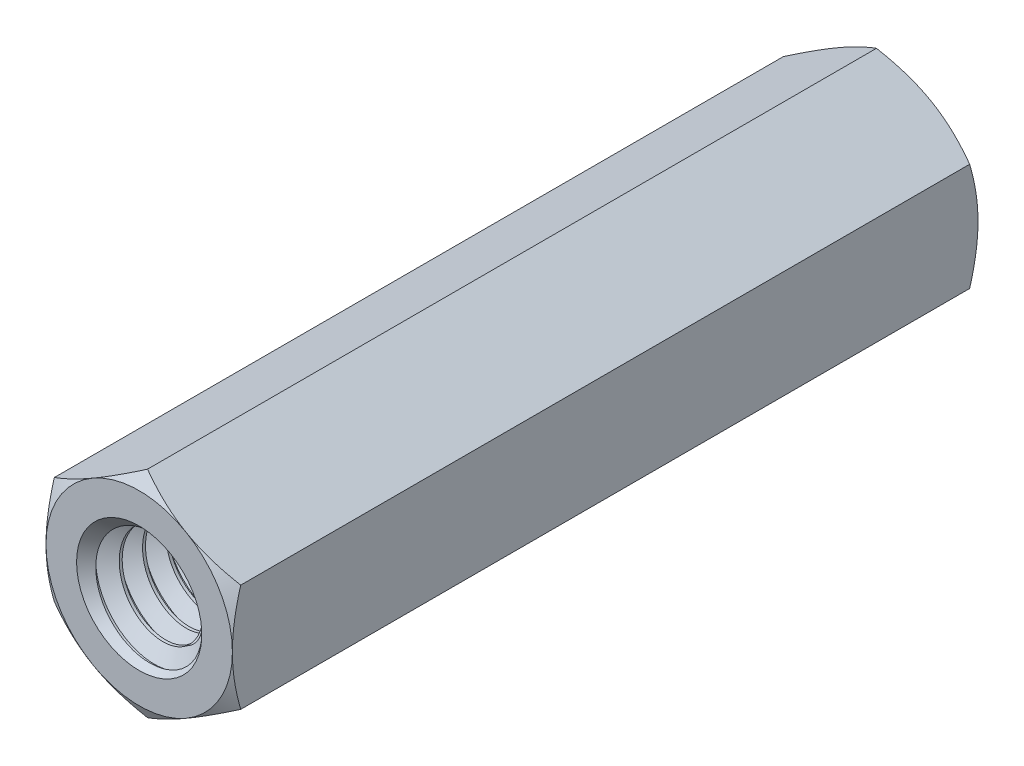
from build123d import *

# Parameters (mm, degrees)
EXTRUDE1_DEPTH          = 12.7
EXTRUDE1_DEPTH_BACK     = 12.7
SKETCH1_R               = 2.0828
SWEEP1_PITCH            = 0.79375
EXTRUDE2_DEPTH          = 27.639126821
SKETCH8_OUTSIDE_W       = 109.682
SKETCH8_OUTSIDE_H       = 110.664
SKETCH8_OUTSIDE_R       = 3.175
EXTRUDE4_DEPTH          = 27.639126821
EXTRUDE4_DRAFT          = -60
MIRROR1_COPY_1_SKETCH_W = 109.682
MIRROR1_COPY_1_SKETCH_H = 110.664
MIRROR1_COPY_1_SKETCH_R = 3.175
MIRROR1_COPY_1_DEPTH    = 27.639126821
MIRROR1_COPY_1_DRAFT    = -60


with BuildPart() as part:
    # Sketch1 → Extrude1 (new, two sides: drawn at the far end of the back side and taken through both)
    with BuildSketch(Plane.XY.offset(-EXTRUDE1_DEPTH_BACK)):
        Polygon((0, 3.666174209), (-3.175, 1.833087105), (-3.175, -1.833087105), (0, -3.666174209), (3.175, -1.833087105), (3.175, 1.833087105), align=None)
        Circle(SKETCH1_R, mode=Mode.SUBTRACT)
    extrude(amount=EXTRUDE1_DEPTH + EXTRUDE1_DEPTH_BACK)

    # Sweep1: arcs per turn and ends read off the stored shape
    # Sweep1: the profile of Sketch12 profile screwed along a right-hand helix through 33 turns, 8 arcs to a turn; built about Z, then put on its axis
    sweep1_z = Axis((0, 0, 0), (0, 0, 1))
    sweep1_corners = [(2.0831, 0, -0.694704455), (2.0831, 0, 0.000173205), (1.567244252, 0, -0.29765625), (1.567244252, 0, -0.396875)]
    with BuildLine(mode=Mode.PRIVATE) as sweep1_profile:
        Line(sweep1_corners[0], sweep1_corners[1])
        Line(sweep1_corners[1], sweep1_corners[2])
        Line(sweep1_corners[2], sweep1_corners[3])
        Line(sweep1_corners[3], sweep1_corners[0])
    sweep1_cap = Face(sweep1_profile.wire())
    sweep1_turn_angles = [0, 22.5, 45, 67.5, 90, 112.5, 135, 157.5, 180, 202.5, 225, 247.5, 270, 292.5, 315, 337.5, 360]
    sweep1_turn_weights = [1, 0.9238795325112867, 1, 0.9238795325112867, 1, 0.9238795325112867, 1, 0.9238795325112867, 1, 0.9238795325112867, 1, 0.9238795325112867, 1, 0.9238795325112867, 1, 0.9238795325112867, 1]
    sweep1_turn_rails = [Edge.make_bspline([Vector(p[0], p[1], 0).rotate(sweep1_z, sweep1_turn_angles[k]) / sweep1_turn_weights[k] + Vector(0, 0, p[2] + SWEEP1_PITCH * sweep1_turn_angles[k] / 360) for k in range(17)], [0, 0, 0, 1, 1, 2, 2, 3, 3, 4, 4, 5, 5, 6, 6, 7, 7, 8, 8, 8], 2, sweep1_turn_weights) for p in sweep1_corners]
    sweep1_turn_sides = [Face.make_surface_from_curves(sweep1_turn_rails[p[0]], sweep1_turn_rails[p[1]]) for p in [(0, 1), (1, 2), (2, 3), (3, 0)]]
    sweep1 = Plane(origin=(0, 0, -12.7), x_dir=(0, 1, 0), z_dir=(0, 0, 1)) * Solid(Shell([*[p.moved(Location((0, 0, SWEEP1_PITCH * i))) for i in range(33) for p in sweep1_turn_sides], sweep1_cap, sweep1_cap.rotate(sweep1_z, 11880).moved(Location((0, 0, SWEEP1_PITCH * 11880 / 360)))]))
    add(sweep1)

    # Sketch6 → Extrude2 (cut, through all)
    with BuildSketch(Plane(origin=(0, 0, -12.7), x_dir=(-1, 0, 0), z_dir=(0, 0, -1))):
        Polygon((0, 3.666174209), (-3.175, 1.833087105), (-3.175, -1.833087105), (0, -3.666174209), (3.175, -1.833087105), (3.175, 1.833087105), align=None)
    extrude2 = extrude(amount=EXTRUDE2_DEPTH, mode=Mode.SUBTRACT)

    # Extrude3 cone 1 section (through the dimple's axis) → Extrude3 (revolve, cut)
    with BuildSketch(Plane(origin=(0, 0, -12.7), x_dir=(0, 1, 0), z_dir=(1, 0, 0))):
        Polygon((0, 0), (2.1336, 0), (0, 2.28800588), align=None)
    extrude3 = revolve(axis=Axis((0, 0, -12.7), (0, 0, 1)), mode=Mode.SUBTRACT)


with BuildPart() as extrude4_tool:
    # Sketch8 outside → Extrude4 (with draft: the straight prism first)
    with BuildSketch(Plane(origin=(0, 0, -12.7), x_dir=(-1, 0, 0), z_dir=(0, 0, -1))):
        Rectangle(SKETCH8_OUTSIDE_W, SKETCH8_OUTSIDE_H)
        Circle(SKETCH8_OUTSIDE_R, mode=Mode.SUBTRACT)
    extrude(amount=-EXTRUDE4_DEPTH)
    # Extrude4: the draft: its side faces are tilted about the plane it starts from
    extrude4_sides = [extrude4_tool.faces().sort_by_distance(p)[0] for p in [
        (0, -55.332, 1.119563411),
        (-54.841, 0, 1.119563411),
        (0, 55.332, 1.119563411),
        (54.841, 0, 1.119563411),
        (3.175, 0, 1.119563411),
    ]]
    draft(extrude4_sides, Plane(origin=(0, 0, -12.7), x_dir=(-1, 0, 0), z_dir=(0, 0, -1)), EXTRUDE4_DRAFT)


with BuildPart() as part_1:
    add(part.part)

    # Extrude4: cut by extrude4_tool
    add(extrude4_tool.part, mode=Mode.SUBTRACT)

    # Mirror1: Extrude2, Extrude3 across plane
    add(extrude2.mirror(Plane.XY), mode=Mode.SUBTRACT)
    add(extrude3.mirror(Plane.XY), mode=Mode.SUBTRACT)


with BuildPart() as mirror1_copy_1_tool:
    # Mirror1 copy 1 sketch → Mirror1 copy 1 (with draft: the straight prism first)
    with BuildSketch(Plane(origin=(0, 0, 12.7), x_dir=(-1, 0, 0), z_dir=(0, 0, 1))):
        Rectangle(MIRROR1_COPY_1_SKETCH_W, MIRROR1_COPY_1_SKETCH_H)
        Circle(MIRROR1_COPY_1_SKETCH_R, mode=Mode.SUBTRACT)
    extrude(amount=-MIRROR1_COPY_1_DEPTH)
    # Mirror1 copy 1: the draft: its side faces are tilted about the plane it starts from
    mirror1_copy_1_sides = [mirror1_copy_1_tool.faces().sort_by_distance(p)[0] for p in [
        (0, -55.332, -1.119563411),
        (-54.841, 0, -1.119563411),
        (0, 55.332, -1.119563411),
        (54.841, 0, -1.119563411),
        (3.175, 0, -1.119563411),
    ]]
    draft(mirror1_copy_1_sides, Plane(origin=(0, 0, 12.7), x_dir=(-1, 0, 0), z_dir=(0, 0, 1)), MIRROR1_COPY_1_DRAFT)


with BuildPart() as part_2:
    add(part_1.part)

    # Mirror1 copy 1: cut by mirror1_copy_1_tool
    add(mirror1_copy_1_tool.part, mode=Mode.SUBTRACT)


solid = part_2.part
